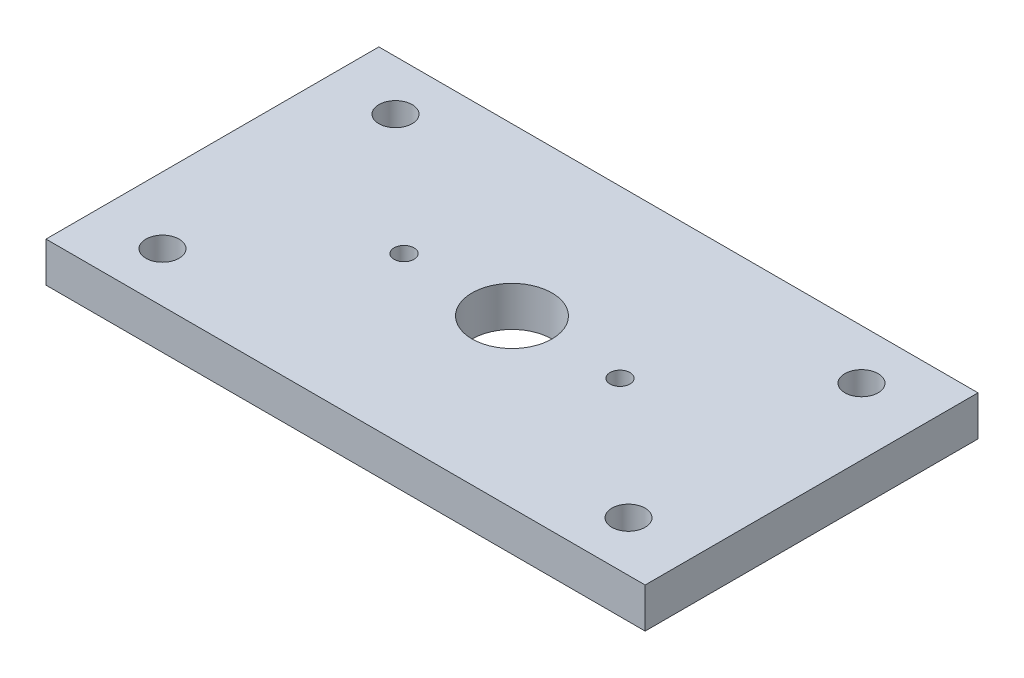
from build123d import *

# Parameters (mm, degrees)
SKETCH1_W           = 90
SKETCH1_H           = 50
SKETCH1_R           = 6
SKETCH1_R_2         = 1.5
SKETCH1_R_3         = 2.5
BOSS_EXTRUDE1_DEPTH = 6
SKETCH2_R           = 6
CUT_EXTRUDE2_DEPTH  = 1.5


with BuildPart() as part:
    # Sketch1 → Boss-Extrude1 (new body)
    with BuildSketch(Plane(origin=(0, 0, 0), x_dir=(1, 0, 0), z_dir=(0, 1, 0))):
        Rectangle(SKETCH1_W, SKETCH1_H)
        Circle(SKETCH1_R, mode=Mode.SUBTRACT)
        with Locations((-16.22, 0)):
            Circle(SKETCH1_R_2, mode=Mode.SUBTRACT)
        with Locations((16.22, 0)):
            Circle(SKETCH1_R_2, mode=Mode.SUBTRACT)
        with Locations((-35, 17.5)):
            Circle(SKETCH1_R_3, mode=Mode.SUBTRACT)
        with Locations((35, 17.5)):
            Circle(SKETCH1_R_3, mode=Mode.SUBTRACT)
        with Locations((35, -17.5)):
            Circle(SKETCH1_R_3, mode=Mode.SUBTRACT)
        with Locations((-35, -17.5)):
            Circle(SKETCH1_R_3, mode=Mode.SUBTRACT)
    extrude(amount=BOSS_EXTRUDE1_DEPTH)

    # Sketch2 → Cut-Extrude2 (cut)
    with BuildSketch(Plane(origin=(0, 0, 0), x_dir=(1, 0, 0), z_dir=(0, 1, 0))):
        with Locations((-35, 17.5)):
            Circle(SKETCH2_R)
        with Locations((35, 17.5)):
            Circle(SKETCH2_R)
        with Locations((35, -17.5)):
            Circle(SKETCH2_R)
        with Locations((-35, -17.5)):
            Circle(SKETCH2_R)
    extrude(amount=CUT_EXTRUDE2_DEPTH, mode=Mode.SUBTRACT)


solid = part.part
